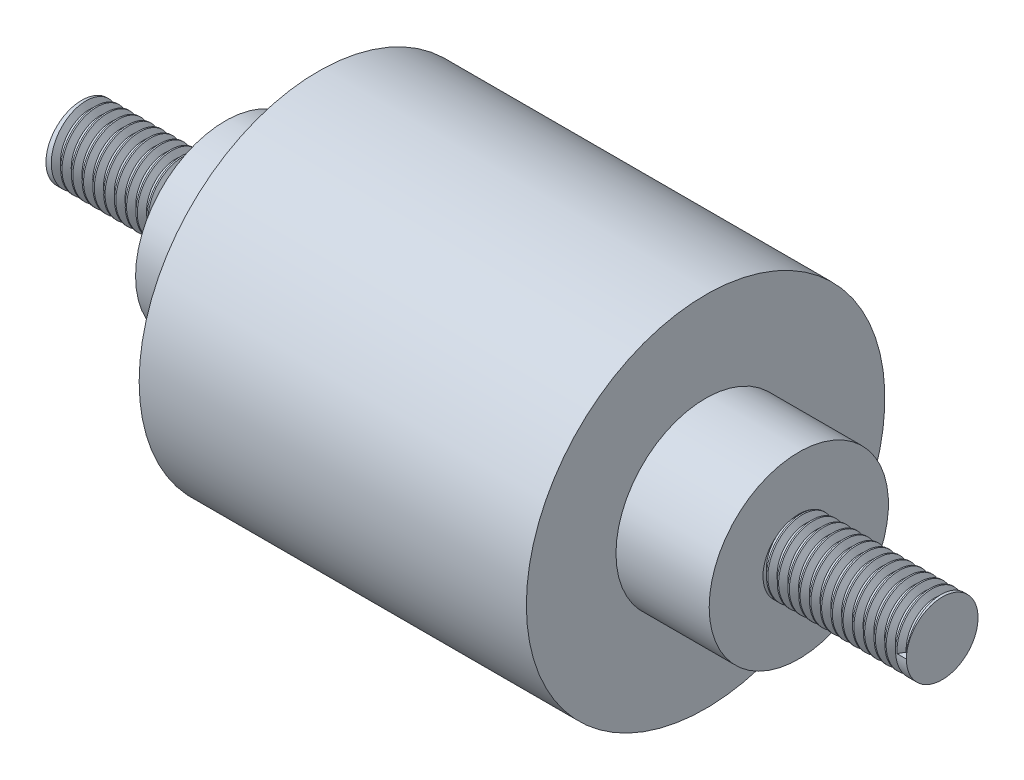
from build123d import *

# Parameters (mm, degrees)
SKETCH2_R           = 5
BOSS_EXTRUDE1_DEPTH = 20
THREAD1_PITCH       = 1.5
THREAD2_PITCH       = 1.5


with BuildPart() as part:
    # Sketch1 → Revolve1 (revolve)
    with BuildSketch(Plane.XY, mode=Mode.PRIVATE) as revolve1_sk:
        Polygon((-40, 0), (-40, 12.5), (-27, 12.5), (-27, 25), (27, 25), (27, 12.5), (40, 12.5), (40, 0), align=None)
    revolve(revolve1_sk.sketch.rotate(Axis((-40, 0, 0), (1, 0, 0)), 90), axis=Axis((-40, 0, 0), (1, 0, 0)))

    # Sketch2 → Boss-Extrude1 (add)
    with BuildSketch(Plane(origin=(40, 0, 0), x_dir=(0, 0, -1), z_dir=(1, 0, 0))):
        Circle(SKETCH2_R)
    boss_extrude1 = extrude(amount=BOSS_EXTRUDE1_DEPTH)

    # Thread1: arcs per turn and ends read off the stored shape
    # Thread1: the profile of Thread Profile1 profile screwed along a right-hand helix through 13.333333 turns, 8 arcs to a turn; built about Z, then put on its axis
    thread1_z = Axis((0, 0, 0), (0, 0, 1))
    thread1_corners = [(5.0003, 0, -0.000173205), (5.0003, 0, 1.312673201), (4.188101188, 0, 0.843749998), (4.188101188, 0, 0.468749998)]
    with BuildLine(mode=Mode.PRIVATE) as thread1_profile:
        Line(thread1_corners[0], thread1_corners[1])
        Line(thread1_corners[1], thread1_corners[2])
        Line(thread1_corners[2], thread1_corners[3])
        Line(thread1_corners[3], thread1_corners[0])
    thread1_cap = Face(thread1_profile.wire())
    thread1_turn_angles = [0, 22.5, 45, 67.5, 90, 112.5, 135, 157.5, 180, 202.5, 225, 247.5, 270, 292.5, 315, 337.5, 360]
    thread1_turn_weights = [1, 0.9238795325112867, 1, 0.9238795325112867, 1, 0.9238795325112867, 1, 0.9238795325112867, 1, 0.9238795325112867, 1, 0.9238795325112867, 1, 0.9238795325112867, 1, 0.9238795325112867, 1]
    thread1_turn_rails = [Edge.make_bspline([Vector(p[0], p[1], 0).rotate(thread1_z, thread1_turn_angles[k]) / thread1_turn_weights[k] + Vector(0, 0, p[2] + THREAD1_PITCH * thread1_turn_angles[k] / 360) for k in range(17)], [0, 0, 0, 1, 1, 2, 2, 3, 3, 4, 4, 5, 5, 6, 6, 7, 7, 8, 8, 8], 2, thread1_turn_weights) for p in thread1_corners]
    thread1_turn_sides = [Face.make_surface_from_curves(thread1_turn_rails[p[0]], thread1_turn_rails[p[1]]) for p in [(0, 1), (1, 2), (2, 3), (3, 0)]]
    thread1_last_angles = [4680, 4702.5, 4725, 4747.5, 4770, 4785, 4800]
    thread1_last_weights = [1, 0.9238795325112867, 1, 0.9238795325112867, 1, 0.9659258262890683, 1]
    thread1_last_rails = [Edge.make_bspline([Vector(p[0], p[1], 0).rotate(thread1_z, thread1_last_angles[k]) / thread1_last_weights[k] + Vector(0, 0, p[2] + THREAD1_PITCH * thread1_last_angles[k] / 360) for k in range(7)], [0, 0, 0, 1, 1, 2, 2, 3, 3, 3], 2, thread1_last_weights) for p in thread1_corners]
    thread1_last_sides = [Face.make_surface_from_curves(thread1_last_rails[p[0]], thread1_last_rails[p[1]]) for p in [(0, 1), (1, 2), (2, 3), (3, 0)]]
    thread1 = Plane(origin=(60, 0, 0), x_dir=(0, 0, 1), z_dir=(-1, 0, 0)) * Solid(Shell([*[p.moved(Location((0, 0, THREAD1_PITCH * i))) for i in range(13) for p in thread1_turn_sides], *thread1_last_sides, thread1_cap, thread1_cap.rotate(thread1_z, 4800).moved(Location((0, 0, THREAD1_PITCH * 4800 / 360)))]))
    add(thread1, mode=Mode.SUBTRACT)

    # Mirror3: Boss-Extrude1 across plane
    add(boss_extrude1.mirror(Plane(origin=(0, 0, 0), x_dir=(0, 0, 1), z_dir=(1, 0, 0))))

    # Thread2: arcs per turn and ends read off the stored shape
    # Thread2: the profile of Thread Profile2 profile screwed along a right-hand helix through 13.333333 turns, 8 arcs to a turn; built about Z, then put on its axis
    thread2_z = Axis((0, 0, 0), (0, 0, 1))
    thread2_corners = [(5.0003, 0, -0.000173205), (5.0003, 0, 1.312673201), (4.188101188, 0, 0.843749998), (4.188101188, 0, 0.468749998)]
    with BuildLine(mode=Mode.PRIVATE) as thread2_profile:
        Line(thread2_corners[0], thread2_corners[1])
        Line(thread2_corners[1], thread2_corners[2])
        Line(thread2_corners[2], thread2_corners[3])
        Line(thread2_corners[3], thread2_corners[0])
    thread2_cap = Face(thread2_profile.wire())
    thread2_turn_angles = [0, 22.5, 45, 67.5, 90, 112.5, 135, 157.5, 180, 202.5, 225, 247.5, 270, 292.5, 315, 337.5, 360]
    thread2_turn_weights = [1, 0.9238795325112867, 1, 0.9238795325112867, 1, 0.9238795325112867, 1, 0.9238795325112867, 1, 0.9238795325112867, 1, 0.9238795325112867, 1, 0.9238795325112867, 1, 0.9238795325112867, 1]
    thread2_turn_rails = [Edge.make_bspline([Vector(p[0], p[1], 0).rotate(thread2_z, thread2_turn_angles[k]) / thread2_turn_weights[k] + Vector(0, 0, p[2] + THREAD2_PITCH * thread2_turn_angles[k] / 360) for k in range(17)], [0, 0, 0, 1, 1, 2, 2, 3, 3, 4, 4, 5, 5, 6, 6, 7, 7, 8, 8, 8], 2, thread2_turn_weights) for p in thread2_corners]
    thread2_turn_sides = [Face.make_surface_from_curves(thread2_turn_rails[p[0]], thread2_turn_rails[p[1]]) for p in [(0, 1), (1, 2), (2, 3), (3, 0)]]
    thread2_last_angles = [4680, 4702.5, 4725, 4747.5, 4770, 4785, 4800]
    thread2_last_weights = [1, 0.9238795325112867, 1, 0.9238795325112867, 1, 0.9659258262890683, 1]
    thread2_last_rails = [Edge.make_bspline([Vector(p[0], p[1], 0).rotate(thread2_z, thread2_last_angles[k]) / thread2_last_weights[k] + Vector(0, 0, p[2] + THREAD2_PITCH * thread2_last_angles[k] / 360) for k in range(7)], [0, 0, 0, 1, 1, 2, 2, 3, 3, 3], 2, thread2_last_weights) for p in thread2_corners]
    thread2_last_sides = [Face.make_surface_from_curves(thread2_last_rails[p[0]], thread2_last_rails[p[1]]) for p in [(0, 1), (1, 2), (2, 3), (3, 0)]]
    thread2 = Plane(origin=(-60, 0, 0), x_dir=(0, 0, -1), z_dir=(1, 0, 0)) * Solid(Shell([*[p.moved(Location((0, 0, THREAD2_PITCH * i))) for i in range(13) for p in thread2_turn_sides], *thread2_last_sides, thread2_cap, thread2_cap.rotate(thread2_z, 4800).moved(Location((0, 0, THREAD2_PITCH * 4800 / 360)))]))
    add(thread2, mode=Mode.SUBTRACT)


solid = part.part
